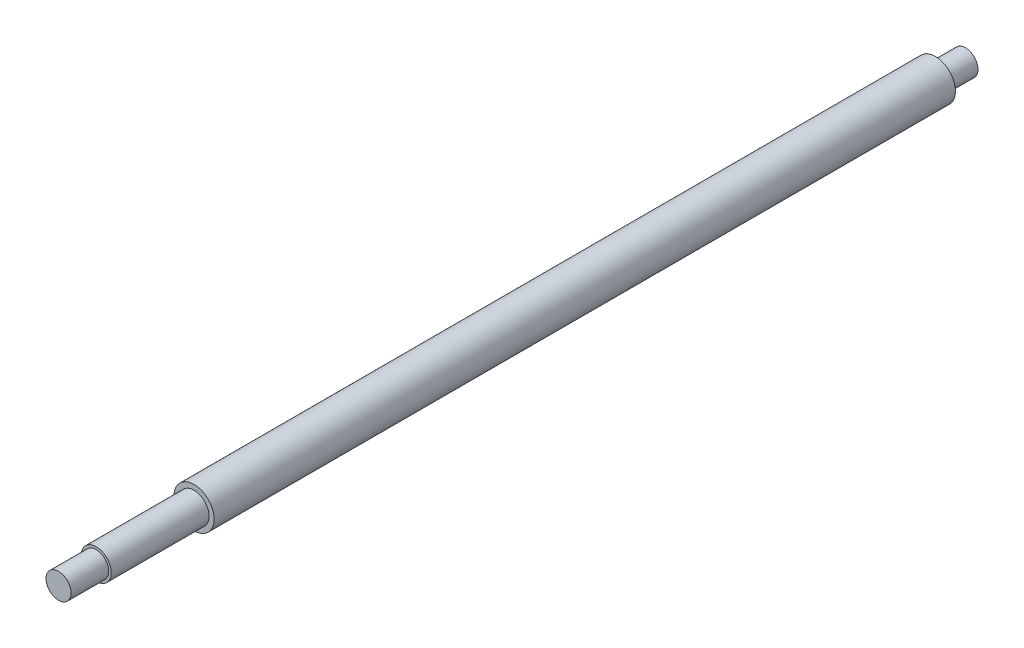
from build123d import *


with BuildPart() as part:
    # Sketch1 → Revolve1 (revolve)
    with BuildSketch(Plane(origin=(0, 0, 0), x_dir=(0, 0, -1), z_dir=(1, 0, 0))):
        Polygon((-350.13, 0), (-350.13, 5), (-335.13, 5), (-335.13, 6), (-296.13, 6), (-296.13, 8), (-0.68, 8), (-0.68, 5), (11.32, 5), (11.32, 0), align=None)
    revolve(axis=Axis((0, 0, 0), (0, 0, 1)))


solid = part.part
